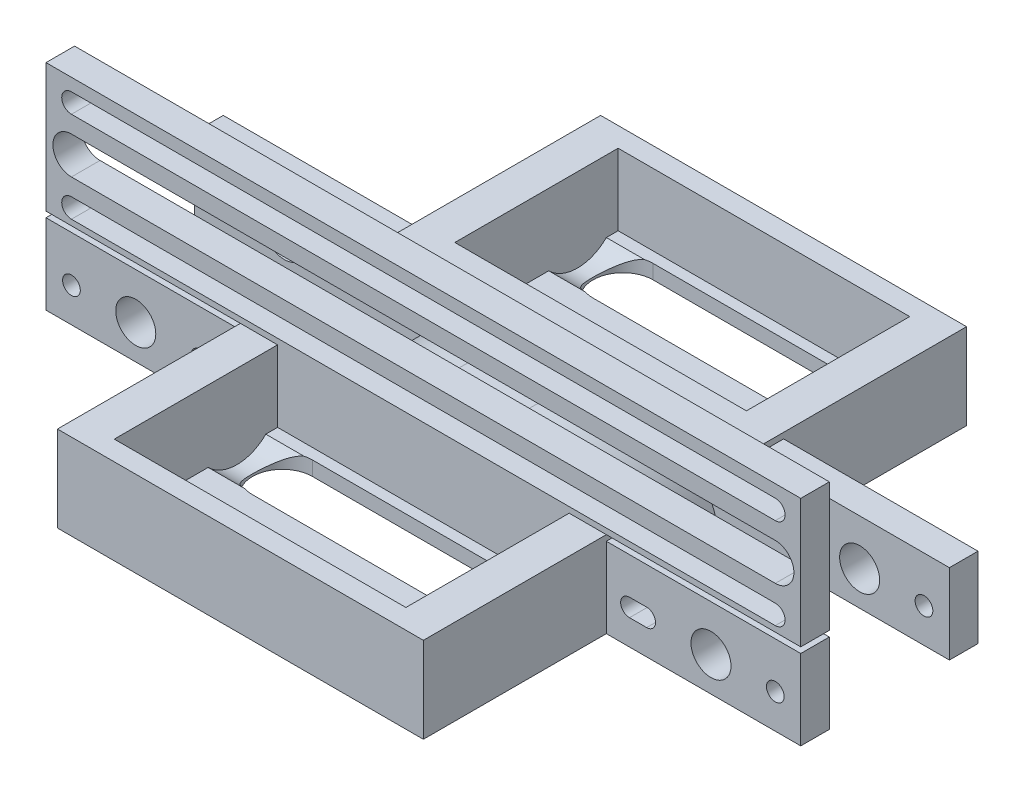
from build123d import *

# Parameters (mm, degrees)
SKETCH1_W                 = 51
SKETCH1_H                 = 28.56
TOTALHEIGHT_DEPTH         = 15
TOTALHEIGHT_2_DEPTH       = 15
SKETCH1_4_W               = 51
SKETCH1_4_H               = 21
MIDDLEFLOORHEIGHT_DEPTH   = 15
SKETCH1_3_W               = 51
SKETCH1_3_H               = 28.56
FLOORHEIGHT_DEPTH         = 2.5
DIPSFORBATTERY_REACH      = 134.749
SKETCH2_4_W               = 34
SKETCH2_4_H               = 1
SKETCH2_4_R               = 1.55
SKETCH2_4_R_2             = 3.5
MOUNTFORDRIVETRAIN_DEPTH  = 5
HOLESFORDRIVESHAFT_REACH  = 152.994
SKETCH2_R                 = 1.55
SKETCH2_R_2               = 3.5
FILLET1_R                 = 20
SLOTSFORPLASTICBARS_REACH = 152.994
SKETCH2_6_W               = 34
SKETCH2_6_H               = 1


with BuildPart() as part:
    # Sketch1 → TotalHeight (new body)
    with BuildSketch(Plane(origin=(0, 0, 0), x_dir=(1, 0, 0), z_dir=(0, 1, 0))):
        Polygon((34, 32), (34, 0), (98, 0), (98, 32), (132, 32), (132, 37), (0, 37), (0, 32), align=None)
        with Locations((66, 17.72)):
            Rectangle(SKETCH1_W, SKETCH1_H, mode=Mode.SUBTRACT)
    extrude(amount=TOTALHEIGHT_DEPTH)



with BuildPart() as body_2:
    # Sketch1 → TotalHeight 2 (new body)
    with BuildSketch(Plane(origin=(0, 0, 0), x_dir=(1, 0, 0), z_dir=(0, 1, 0))):
        Polygon((0, 63), (0, 58), (132, 58), (132, 63), (98, 63), (98, 95), (34, 95), (34, 63), align=None)
        with Locations((66, 77.28)):
            Rectangle(SKETCH1_W, SKETCH1_H, mode=Mode.SUBTRACT)
    extrude(amount=TOTALHEIGHT_2_DEPTH)


with BuildPart() as part_1:
    add(part.part)

    add(body_2.part)  # MiddleFloorHeight merges body 2
    # Sketch1<4> → MiddleFloorHeight (add)
    with BuildSketch(Plane(origin=(0, 0, 0), x_dir=(1, 0, 0), z_dir=(0, 1, 0))):
        with Locations((66, 47.5)):
            Rectangle(SKETCH1_4_W, SKETCH1_4_H)
    extrude(amount=MIDDLEFLOORHEIGHT_DEPTH)

    # Sketch1<3> → FloorHeight (add)
    # profile 1 of 2: a face of its own
    with BuildSketch(Plane(origin=(0, 0, 0), x_dir=(1, 0, 0), z_dir=(0, 1, 0))):
        with Locations((66, 77.28)):
            Rectangle(SKETCH1_3_W, SKETCH1_3_H)
        with BuildLine():
            ThreePointArc((83.5, 79.17), (88.75, 84.42), (83.5, 89.67))
            Line((83.5, 89.67), (48.5, 89.67))
            ThreePointArc((48.5, 89.67), (43.25, 84.42), (48.5, 79.17))
            Line((48.5, 79.17), (83.5, 79.17))
        make_face(mode=Mode.SUBTRACT)
        with BuildLine():
            Line((48.5, 75.39), (83.5, 75.39))
            ThreePointArc((83.5, 75.39), (88.75, 70.14), (83.5, 64.89))
            Line((83.5, 64.89), (48.5, 64.89))
            ThreePointArc((48.5, 64.89), (43.25, 70.14), (48.5, 75.39))
        make_face(mode=Mode.SUBTRACT)
    # profile 2 of 2: a face of its own
    with BuildSketch(Plane(origin=(0, 0, 0), x_dir=(1, 0, 0), z_dir=(0, 1, 0))):
        with Locations((66, 17.72)):
            Rectangle(SKETCH1_3_W, SKETCH1_3_H)
        with BuildLine():
            ThreePointArc((83.5, 19.61), (88.75, 24.86), (83.5, 30.11))
            Line((83.5, 30.11), (48.5, 30.11))
            ThreePointArc((48.5, 30.11), (43.25, 24.86), (48.5, 19.61))
            Line((48.5, 19.61), (83.5, 19.61))
        make_face(mode=Mode.SUBTRACT)
        with BuildLine():
            Line((48.5, 15.83), (83.5, 15.83))
            ThreePointArc((83.5, 15.83), (88.75, 10.58), (83.5, 5.33))
            Line((83.5, 5.33), (48.5, 5.33))
            ThreePointArc((48.5, 5.33), (43.25, 10.58), (48.5, 15.83))
        make_face(mode=Mode.SUBTRACT)
    extrude(amount=FLOORHEIGHT_DEPTH)

    # DipsForBattery: up to this face of the body (flat: up to its plane)
    dipsforbattery_end = Plane(part_1.part.faces().sort_by_distance((40.5, 8.75, -77.28))[0])
    # Sketch3 → DipsForBattery (cut, up to the picked face)
    with BuildSketch(Plane.ZY.offset(-91.5), mode=Mode.PRIVATE) as dipsforbattery_sk1:
        with BuildLine():
            ThreePointArc((-77.36, 7.5), (-87.163708918, 14.065055833), (-89.500833264, 2.5))
            Line((-89.500833264, 2.5), (-79.419166736, 2.5))
            ThreePointArc((-79.419166736, 2.5), (-77.894944167, 4.796291082), (-77.36, 7.5))
        make_face()
    dipsforbattery_tool1 = split(extrude(dipsforbattery_sk1.sketch, amount=DIPSFORBATTERY_REACH, mode=Mode.PRIVATE), bisect_by=dipsforbattery_end, keep=Keep.BOTH, mode=Mode.PRIVATE)
    # Sketch3 → DipsForBattery (cut, up to the picked face)
    with BuildSketch(Plane.ZY.offset(-91.5), mode=Mode.PRIVATE) as dipsforbattery_sk2:
        with BuildLine():
            Line((-79.419166736, 2.5), (-89.500833264, 2.5))
            ThreePointArc((-89.500833264, 2.5), (-84.46, 0.4), (-79.419166736, 2.5))
        make_face()
    dipsforbattery_tool2 = split(extrude(dipsforbattery_sk2.sketch, amount=DIPSFORBATTERY_REACH, mode=Mode.PRIVATE), bisect_by=dipsforbattery_end, keep=Keep.BOTH, mode=Mode.PRIVATE)
    # Sketch3 → DipsForBattery (cut, up to the picked face)
    with BuildSketch(Plane.ZY.offset(-91.5), mode=Mode.PRIVATE) as dipsforbattery_sk3:
        with BuildLine():
            ThreePointArc((-63, 7.5), (-72.803708918, 14.065055833), (-75.140833264, 2.5))
            Line((-75.140833264, 2.5), (-65.059166736, 2.5))
            ThreePointArc((-65.059166736, 2.5), (-63.534944167, 4.796291082), (-63, 7.5))
        make_face()
    dipsforbattery_tool3 = split(extrude(dipsforbattery_sk3.sketch, amount=DIPSFORBATTERY_REACH, mode=Mode.PRIVATE), bisect_by=dipsforbattery_end, keep=Keep.BOTH, mode=Mode.PRIVATE)
    # Sketch3 → DipsForBattery (cut, up to the picked face)
    with BuildSketch(Plane.ZY.offset(-91.5), mode=Mode.PRIVATE) as dipsforbattery_sk4:
        with BuildLine():
            Line((-65.059166736, 2.5), (-75.140833264, 2.5))
            ThreePointArc((-75.140833264, 2.5), (-70.1, 0.4), (-65.059166736, 2.5))
        make_face()
    dipsforbattery_tool4 = split(extrude(dipsforbattery_sk4.sketch, amount=DIPSFORBATTERY_REACH, mode=Mode.PRIVATE), bisect_by=dipsforbattery_end, keep=Keep.BOTH, mode=Mode.PRIVATE)
    # Sketch3 → DipsForBattery (cut, up to the picked face)
    with BuildSketch(Plane.ZY.offset(-91.5), mode=Mode.PRIVATE) as dipsforbattery_sk5:
        with BuildLine():
            ThreePointArc((-29.940833264, 2.5), (-24.9, 0.4), (-19.859166736, 2.5))
            Line((-19.859166736, 2.5), (-29.940833264, 2.5))
        make_face()
    dipsforbattery_tool5 = split(extrude(dipsforbattery_sk5.sketch, amount=DIPSFORBATTERY_REACH, mode=Mode.PRIVATE), bisect_by=dipsforbattery_end, keep=Keep.BOTH, mode=Mode.PRIVATE)
    # Sketch3 → DipsForBattery (cut, up to the picked face)
    with BuildSketch(Plane.ZY.offset(-91.5), mode=Mode.PRIVATE) as dipsforbattery_sk6:
        with BuildLine():
            Line((-29.940833264, 2.5), (-19.859166736, 2.5))
            ThreePointArc((-19.859166736, 2.5), (-18.334944167, 4.796291082), (-17.8, 7.5))
            ThreePointArc((-17.8, 7.5), (-27.603708918, 14.065055833), (-29.940833264, 2.5))
        make_face()
    dipsforbattery_tool6 = split(extrude(dipsforbattery_sk6.sketch, amount=DIPSFORBATTERY_REACH, mode=Mode.PRIVATE), bisect_by=dipsforbattery_end, keep=Keep.BOTH, mode=Mode.PRIVATE)
    # Sketch3 → DipsForBattery (cut, up to the picked face)
    with BuildSketch(Plane.ZY.offset(-91.5), mode=Mode.PRIVATE) as dipsforbattery_sk7:
        with BuildLine():
            ThreePointArc((-15.580833264, 2.5), (-10.54, 0.4), (-5.499166736, 2.5))
            Line((-5.499166736, 2.5), (-15.580833264, 2.5))
        make_face()
    dipsforbattery_tool7 = split(extrude(dipsforbattery_sk7.sketch, amount=DIPSFORBATTERY_REACH, mode=Mode.PRIVATE), bisect_by=dipsforbattery_end, keep=Keep.BOTH, mode=Mode.PRIVATE)
    # Sketch3 → DipsForBattery (cut, up to the picked face)
    with BuildSketch(Plane.ZY.offset(-91.5), mode=Mode.PRIVATE) as dipsforbattery_sk8:
        with BuildLine():
            Line((-15.580833264, 2.5), (-5.499166736, 2.5))
            ThreePointArc((-5.499166736, 2.5), (-3.974944167, 4.796291082), (-3.44, 7.5))
            ThreePointArc((-3.44, 7.5), (-13.243708918, 14.065055833), (-15.580833264, 2.5))
        make_face()
    dipsforbattery_tool8 = split(extrude(dipsforbattery_sk8.sketch, amount=DIPSFORBATTERY_REACH, mode=Mode.PRIVATE), bisect_by=dipsforbattery_end, keep=Keep.BOTH, mode=Mode.PRIVATE)
    add(dipsforbattery_tool1.solids().sort_by(Axis((91.5, 8.093926, -84.46), (-1, 0, 0)))[0], mode=Mode.SUBTRACT)
    add(dipsforbattery_tool2.solids().sort_by(Axis((91.5, 1.64835, -84.46), (-1, 0, 0)))[0], mode=Mode.SUBTRACT)
    add(dipsforbattery_tool3.solids().sort_by(Axis((91.5, 8.093926, -70.1), (-1, 0, 0)))[0], mode=Mode.SUBTRACT)
    add(dipsforbattery_tool4.solids().sort_by(Axis((91.5, 1.64835, -70.1), (-1, 0, 0)))[0], mode=Mode.SUBTRACT)
    add(dipsforbattery_tool5.solids().sort_by(Axis((91.5, 1.64835, -24.9), (-1, 0, 0)))[0], mode=Mode.SUBTRACT)
    add(dipsforbattery_tool6.solids().sort_by(Axis((91.5, 8.093926, -24.9), (-1, 0, 0)))[0], mode=Mode.SUBTRACT)
    add(dipsforbattery_tool7.solids().sort_by(Axis((91.5, 1.64835, -10.54), (-1, 0, 0)))[0], mode=Mode.SUBTRACT)
    add(dipsforbattery_tool8.solids().sort_by(Axis((91.5, 8.093926, -10.54), (-1, 0, 0)))[0], mode=Mode.SUBTRACT)

    # Sketch2<4> → MountForDriveTrain (add)
    # profile 1 of 4: a face of its own
    with BuildSketch(Plane.XY.offset(-32)):
        Polygon((0, 37.5), (0, 15), (34, 15), (98, 15), (132, 15), (132, 37.5), align=None)
        with BuildLine():
            ThreePointArc((4.45, 16), (2.75, 17.7), (4.45, 19.4))
            Line((4.45, 19.4), (127.55, 19.4))
            ThreePointArc((127.55, 19.4), (129.25, 17.7), (127.55, 16))
            Line((127.55, 16), (4.45, 16))
        make_face(mode=Mode.SUBTRACT)
        with BuildLine():
            ThreePointArc((4.45, 22.4), (1.2, 25.65), (4.45, 28.9))
            Line((4.45, 28.9), (127.55, 28.9))
            ThreePointArc((127.55, 28.9), (130.8, 25.65), (127.55, 22.4))
            Line((127.55, 22.4), (4.45, 22.4))
        make_face(mode=Mode.SUBTRACT)
        with BuildLine():
            ThreePointArc((4.45, 31.9), (2.75, 33.6), (4.45, 35.3))
            Line((4.45, 35.3), (127.55, 35.3))
            ThreePointArc((127.55, 35.3), (129.25, 33.6), (127.55, 31.9))
            Line((127.55, 31.9), (4.45, 31.9))
        make_face(mode=Mode.SUBTRACT)
    # profile 2 of 4: a face of its own
    with BuildSketch(Plane.XY.offset(-32)):
        with Locations((17, 14.5)):
            Rectangle(SKETCH2_4_W, SKETCH2_4_H)
    # profile 3 of 4: a face of its own
    with BuildSketch(Plane.XY.offset(-32)):
        Polygon((98, 15), (34, 15), (34, 14), (0, 14), (0, 0), (132, 0), (132, 14), (98, 14), align=None)
        with Locations((4.45, 6)):
            Circle(SKETCH2_4_R, mode=Mode.SUBTRACT)
        with Locations((15.7, 6)):
            Circle(SKETCH2_4_R_2, mode=Mode.SUBTRACT)
        with BuildLine():
            ThreePointArc((26.95, 4.45), (25.4, 6), (26.95, 7.55))
            Line((26.95, 7.55), (29.95, 7.55))
            ThreePointArc((29.95, 7.55), (31.5, 6), (29.95, 4.45))
            Line((29.95, 4.45), (26.95, 4.45))
        make_face(mode=Mode.SUBTRACT)
        with BuildLine():
            Line((102.05, 7.55), (105.05, 7.55))
            ThreePointArc((105.05, 7.55), (106.6, 6), (105.05, 4.45))
            Line((105.05, 4.45), (102.05, 4.45))
            ThreePointArc((102.05, 4.45), (100.5, 6), (102.05, 7.55))
        make_face(mode=Mode.SUBTRACT)
        with Locations((116.3, 6)):
            Circle(SKETCH2_4_R_2, mode=Mode.SUBTRACT)
        with Locations((127.55, 6)):
            Circle(SKETCH2_4_R, mode=Mode.SUBTRACT)
    # profile 4 of 4: a face of its own
    with BuildSketch(Plane.XY.offset(-32)):
        with Locations((115, 14.5)):
            Rectangle(SKETCH2_4_W, SKETCH2_4_H)
    extrude(amount=-MOUNTFORDRIVETRAIN_DEPTH)

    # HolesForDriveShaft: up to this face of the body (flat: up to its plane)
    holesfordriveshaft_end = Plane(part_1.part.faces().sort_by_distance((115, 7.5, -63))[0])
    # Sketch2 → HolesForDriveShaft (cut, up to the picked face)
    with BuildSketch(Plane.XY.offset(-32), mode=Mode.PRIVATE) as holesfordriveshaft_sk1:
        with Locations(Location((4.45, 6, 0), (0, 0, 180))):
            Circle(SKETCH2_R)
    holesfordriveshaft_tool1 = split(extrude(holesfordriveshaft_sk1.sketch, amount=-HOLESFORDRIVESHAFT_REACH, mode=Mode.PRIVATE), bisect_by=holesfordriveshaft_end, keep=Keep.BOTH, mode=Mode.PRIVATE)
    # Sketch2 → HolesForDriveShaft (cut, up to the picked face)
    with BuildSketch(Plane.XY.offset(-32), mode=Mode.PRIVATE) as holesfordriveshaft_sk2:
        with Locations(Location((15.7, 6, 0), (0, 0, 180))):
            Circle(SKETCH2_R_2)
    holesfordriveshaft_tool2 = split(extrude(holesfordriveshaft_sk2.sketch, amount=-HOLESFORDRIVESHAFT_REACH, mode=Mode.PRIVATE), bisect_by=holesfordriveshaft_end, keep=Keep.BOTH, mode=Mode.PRIVATE)
    # Sketch2 → HolesForDriveShaft (cut, up to the picked face)
    with BuildSketch(Plane.XY.offset(-32), mode=Mode.PRIVATE) as holesfordriveshaft_sk3:
        with BuildLine():
            Line((26.95, 4.45), (29.95, 4.45))
            ThreePointArc((29.95, 4.45), (31.5, 6), (29.95, 7.55))
            Line((29.95, 7.55), (26.95, 7.55))
            ThreePointArc((26.95, 7.55), (25.4, 6), (26.95, 4.45))
        make_face()
    holesfordriveshaft_tool3 = split(extrude(holesfordriveshaft_sk3.sketch, amount=-HOLESFORDRIVESHAFT_REACH, mode=Mode.PRIVATE), bisect_by=holesfordriveshaft_end, keep=Keep.BOTH, mode=Mode.PRIVATE)
    # Sketch2 → HolesForDriveShaft (cut, up to the picked face)
    with BuildSketch(Plane.XY.offset(-32), mode=Mode.PRIVATE) as holesfordriveshaft_sk4:
        with BuildLine():
            ThreePointArc((102.05, 4.45), (100.5, 6), (102.05, 7.55))
            Line((102.05, 7.55), (105.05, 7.55))
            ThreePointArc((105.05, 7.55), (106.6, 6), (105.05, 4.45))
            Line((105.05, 4.45), (102.05, 4.45))
        make_face()
    holesfordriveshaft_tool4 = split(extrude(holesfordriveshaft_sk4.sketch, amount=-HOLESFORDRIVESHAFT_REACH, mode=Mode.PRIVATE), bisect_by=holesfordriveshaft_end, keep=Keep.BOTH, mode=Mode.PRIVATE)
    # Sketch2 → HolesForDriveShaft (cut, up to the picked face)
    with BuildSketch(Plane.XY.offset(-32), mode=Mode.PRIVATE) as holesfordriveshaft_sk5:
        with Locations(Location((116.3, 6, 0), (0, 0, 180))):
            Circle(SKETCH2_R_2)
    holesfordriveshaft_tool5 = split(extrude(holesfordriveshaft_sk5.sketch, amount=-HOLESFORDRIVESHAFT_REACH, mode=Mode.PRIVATE), bisect_by=holesfordriveshaft_end, keep=Keep.BOTH, mode=Mode.PRIVATE)
    # Sketch2 → HolesForDriveShaft (cut, up to the picked face)
    with BuildSketch(Plane.XY.offset(-32), mode=Mode.PRIVATE) as holesfordriveshaft_sk6:
        with Locations(Location((127.55, 6, 0), (0, 0, 180))):
            Circle(SKETCH2_R)
    holesfordriveshaft_tool6 = split(extrude(holesfordriveshaft_sk6.sketch, amount=-HOLESFORDRIVESHAFT_REACH, mode=Mode.PRIVATE), bisect_by=holesfordriveshaft_end, keep=Keep.BOTH, mode=Mode.PRIVATE)
    add(holesfordriveshaft_tool1.solids().sort_by(Axis((4.45, 6, -32), (0, 0, -1)))[0], mode=Mode.SUBTRACT)
    add(holesfordriveshaft_tool2.solids().sort_by(Axis((15.7, 6, -32), (0, 0, -1)))[0], mode=Mode.SUBTRACT)
    add(holesfordriveshaft_tool3.solids().sort_by(Axis((28.45, 6, -32), (0, 0, -1)))[0], mode=Mode.SUBTRACT)
    add(holesfordriveshaft_tool4.solids().sort_by(Axis((103.55, 6, -32), (0, 0, -1)))[0], mode=Mode.SUBTRACT)
    add(holesfordriveshaft_tool5.solids().sort_by(Axis((116.3, 6, -32), (0, 0, -1)))[0], mode=Mode.SUBTRACT)
    add(holesfordriveshaft_tool6.solids().sort_by(Axis((127.55, 6, -32), (0, 0, -1)))[0], mode=Mode.SUBTRACT)

    # Fillet1
    # the kernel refuses this fillet: 20 mm, written as the material it takes off along each edge
    with BuildSketch(Plane(origin=(40.5, 15, -58), x_dir=(1, 0, 0), z_dir=(0, 0, 1)), Plane(origin=(91.5, 15, -37), x_dir=(-1, 0, 0), z_dir=(0, 0, -1))) as fillet1_piece_1:
        with BuildLine():
            CenterArc((19.364916731, -20), FILLET1_R, 90, 75.522487814)
            Line((0, -15), (-0.387298335, -14.9))
            ThreePointArc((-0.387298335, -14.9), (-0.4, -7.5), (-0.4, 0))
            Line((-0.4, 0), (0, 0.4))
            Line((0, 0.4), (19.364916731, 0.4))
            Line((19.364916731, 0.4), (19.364916731, 0))
        make_face()
    extrude(amount=21, mode=Mode.SUBTRACT)

    # SlotsForPlasticBars: up to this face of the body (flat: up to its plane)
    slotsforplasticbars_end = Plane(part_1.part.faces().sort_by_distance((33.628381916, 7.5, -63))[0])
    # Sketch2<6> → SlotsForPlasticBars (cut, up to the picked face)
    with BuildSketch(Plane.XY.offset(-32), mode=Mode.PRIVATE) as slotsforplasticbars_sk1:
        with Locations((115, 14.5)):
            Rectangle(SKETCH2_6_W, SKETCH2_6_H)
    slotsforplasticbars_tool1 = split(extrude(slotsforplasticbars_sk1.sketch, amount=-SLOTSFORPLASTICBARS_REACH, mode=Mode.PRIVATE), bisect_by=slotsforplasticbars_end, keep=Keep.BOTH, mode=Mode.PRIVATE)
    # Sketch2<6> → SlotsForPlasticBars (cut, up to the picked face)
    with BuildSketch(Plane.XY.offset(-32), mode=Mode.PRIVATE) as slotsforplasticbars_sk2:
        with Locations((17, 14.5)):
            Rectangle(SKETCH2_6_W, SKETCH2_6_H)
    slotsforplasticbars_tool2 = split(extrude(slotsforplasticbars_sk2.sketch, amount=-SLOTSFORPLASTICBARS_REACH, mode=Mode.PRIVATE), bisect_by=slotsforplasticbars_end, keep=Keep.BOTH, mode=Mode.PRIVATE)
    add(slotsforplasticbars_tool1.solids().sort_by(Axis((115, 14.5, -32), (0, 0, -1)))[0], mode=Mode.SUBTRACT)
    add(slotsforplasticbars_tool2.solids().sort_by(Axis((17, 14.5, -32), (0, 0, -1)))[0], mode=Mode.SUBTRACT)


solid = part_1.part
